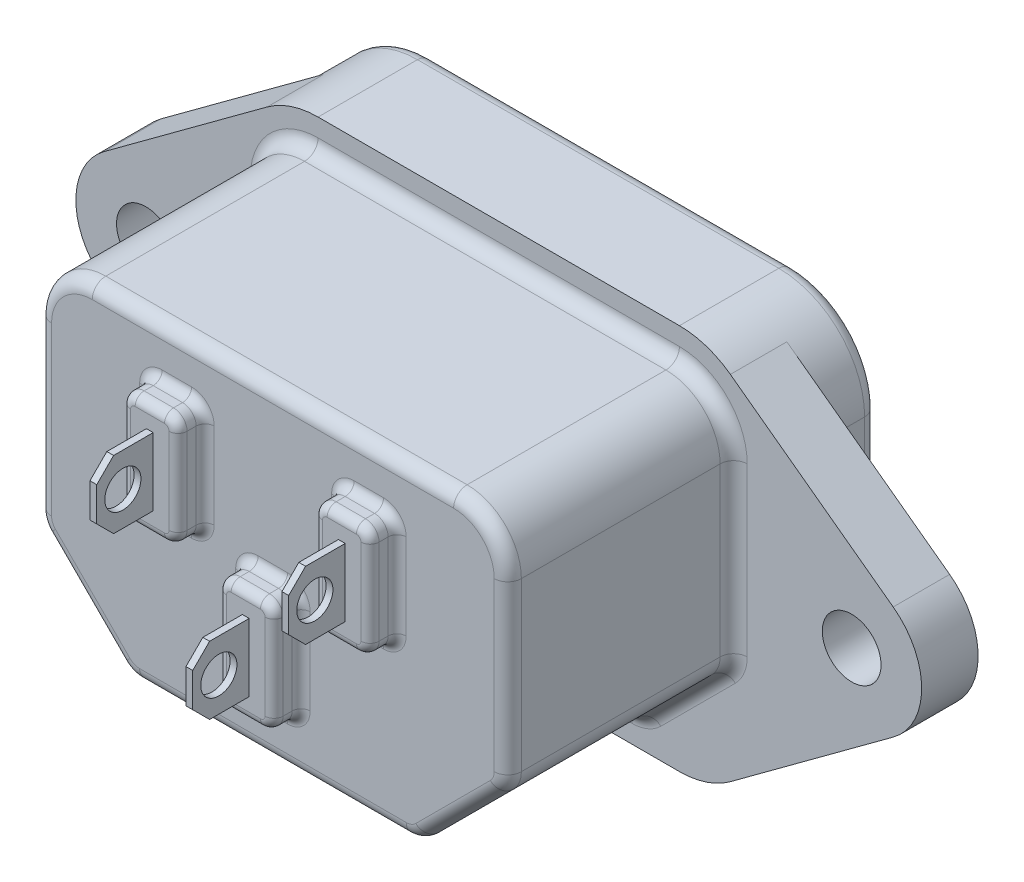
from build123d import *

# Parameters (mm, degrees)
BASE_EXTRUDE_DEPTH       = 3.175
BOSS_EXTRUDE1_START      = 3.175
SKETCH2_R                = 1.651
BOSS_EXTRUDE1_DEPTH      = 3.175
BOSS_EXTRUDE2_DEPTH      = 12.7
FILLET1_R                = 1.524
FILLET2_R                = 0.762
FILLET3_R                = 0.762
CUT_EXTRUDE1_DEPTH       = 16.891
FILLET4_R                = 0.762
FILLET5_R                = 0.762
BOSS_EXTRUDE3_DEPTH      = 1.524
FILLET6_R                = 0.508
BOSS_EXTRUDE4_DEPTH      = 3.175
BOSS_EXTRUDE4_DEPTH_BACK = 19.05
SKETCH6_W                = 1.905
SKETCH6_H                = 3.81
CUT_EXTRUDE2_START       = -3.175
CUT_EXTRUDE2_DEPTH       = 3.175
SKETCH8_R                = 1.016
CUT_EXTRUDE3_DEPTH       = 50.878764956
CUT_EXTRUDE4_START       = -10.16
CUT_EXTRUDE4_DEPTH       = 10.16


with BuildPart() as part:
    # Sketch1 → Base-Extrude (new body)
    with BuildSketch(Plane.XY):
        with BuildLine():
            Line((-54.229, 34.671), (-33.909, 34.671))
            ThreePointArc((-33.909, 34.671), (-30.496502674, 33.257497326), (-29.083, 29.845))
            Line((-29.083, 29.845), (-29.083, 17.78))
            ThreePointArc((-29.083, 17.78), (-30.496502674, 14.367502674), (-33.909, 12.954))
            Line((-33.909, 12.954), (-54.229, 12.954))
            ThreePointArc((-54.229, 12.954), (-57.641497326, 14.367502674), (-59.055, 17.78))
            Line((-59.055, 17.78), (-59.055, 29.845))
            ThreePointArc((-59.055, 29.845), (-57.641497326, 33.257497326), (-54.229, 34.671))
        make_face()
    extrude(amount=-BASE_EXTRUDE_DEPTH)

    # Sketch2 → Boss-Extrude1 (add)
    with BuildSketch(Plane.XY.offset(BOSS_EXTRUDE1_START)):
        with BuildLine():
            Line((-54.229, 12.954), (-33.909, 12.954))
            ThreePointArc((-33.909, 12.954), (-32.402074413, 13.195302488), (-31.045842939, 13.895079455))
            Line((-31.045842939, 13.895079455), (-21.889516608, 20.643222713))
            ThreePointArc((-21.889516608, 20.643222713), (-20.28825, 23.8125), (-21.889516608, 26.981777287))
            Line((-21.889516608, 26.981777287), (-31.045842939, 33.729920545))
            ThreePointArc((-31.045842939, 33.729920545), (-32.402074413, 34.429697512), (-33.909, 34.671))
            Line((-33.909, 34.671), (-54.229, 34.671))
            ThreePointArc((-54.229, 34.671), (-55.735925587, 34.429697512), (-57.092157061, 33.729920545))
            Line((-57.092157061, 33.729920545), (-66.248483392, 26.981777287))
            ThreePointArc((-66.248483392, 26.981777287), (-67.84975, 23.8125), (-66.248483392, 20.643222713))
            Line((-66.248483392, 20.643222713), (-57.092157061, 13.895079455))
            ThreePointArc((-57.092157061, 13.895079455), (-55.735925587, 13.195302488), (-54.229, 12.954))
        make_face()
        with Locations((-63.91275, 23.8125)):
            Circle(SKETCH2_R, mode=Mode.SUBTRACT)
        with Locations((-24.22525, 23.8125)):
            Circle(SKETCH2_R, mode=Mode.SUBTRACT)
    extrude(amount=-BOSS_EXTRUDE1_DEPTH)

    # Sketch3 → Boss-Extrude2 (add)
    with BuildSketch(Plane.XY.offset(3.175)):
        with BuildLine():
            Line((-30.861, 19.812), (-35.941, 14.732))
            Line((-35.941, 14.732), (-52.197, 14.732))
            Line((-52.197, 14.732), (-57.277, 19.812))
            Line((-57.277, 19.812), (-57.277, 29.845))
            ThreePointArc((-57.277, 29.845), (-56.384261469, 32.000261469), (-54.229, 32.893))
            Line((-54.229, 32.893), (-33.909, 32.893))
            ThreePointArc((-33.909, 32.893), (-31.753738531, 32.000261469), (-30.861, 29.845))
            Line((-30.861, 29.845), (-30.861, 19.812))
        make_face()
    extrude(amount=BOSS_EXTRUDE2_DEPTH)

    # Fillet1
    fillet1_edges = [part.edges().sort_by_distance(p)[0] for p in [
        (-57.277, 19.812, 9.525),
        (-52.197, 14.732, 9.525),
        (-35.941, 14.732, 9.525),
        (-30.861, 19.812, 9.525),
    ]]
    fillet(fillet1_edges, radius=FILLET1_R)

    # Fillet2
    fillet2_edges = [part.edges().sort_by_distance(p)[0] for p in [
        (-56.384261469, 32.000261469, 3.175),
        (-31.753738531, 32.000261469, 3.175),
        (-44.069, 32.893, 3.175),
        (-30.861, 25.144130735, 3.175),
        (-33.401, 17.272, 3.175),
        (-44.069, 14.732, 3.175),
        (-54.737, 17.272, 3.175),
        (-57.277, 25.144130735, 3.175),
        (-30.977007592, 19.860051918, 3.175),
        (-35.989051918, 14.848007592, 3.175),
        (-52.148948082, 14.848007592, 3.175),
        (-57.160992408, 19.860051918, 3.175),
    ]]
    fillet(fillet2_edges, radius=FILLET2_R)

    # Fillet3
    fillet3_edges = [part.edges().sort_by_distance(p)[0] for p in [
        (-57.641497326, 14.367502674, -3.175),
        (-44.069, 12.954, -3.175),
        (-30.496502674, 14.367502674, -3.175),
        (-29.083, 23.8125, -3.175),
        (-30.496502674, 33.257497326, -3.175),
        (-44.069, 34.671, -3.175),
        (-57.641497326, 33.257497326, -3.175),
        (-59.055, 23.8125, -3.175),
        (-30.861, 25.144130735, 15.875),
        (-44.069, 32.893, 15.875),
        (-56.384261469, 32.000261469, 15.875),
        (-31.753738531, 32.000261469, 15.875),
        (-33.401, 17.272, 15.875),
        (-57.277, 25.144130735, 15.875),
        (-54.737, 17.272, 15.875),
        (-44.069, 14.732, 15.875),
        (-57.160992408, 19.860051918, 15.875),
        (-52.148948082, 14.848007592, 15.875),
        (-35.989051918, 14.848007592, 15.875),
        (-30.977007592, 19.860051918, 15.875),
    ]]
    fillet(fillet3_edges, radius=FILLET3_R)

    # Sketch4 → Cut-Extrude1 (cut)
    with BuildSketch(Plane(origin=(0, 0, -3.175), x_dir=(-1, 0, 0), z_dir=(0, 0, -1))):
        with BuildLine():
            Line((55.499, 20.548471714), (51.460528286, 16.51))
            Line((51.460528286, 16.51), (36.677471714, 16.51))
            Line((36.677471714, 16.51), (32.639, 20.548471714))
            Line((32.639, 20.548471714), (32.639, 29.845))
            ThreePointArc((32.639, 29.845), (33.010974388, 30.743025612), (33.909, 31.115))
            Line((33.909, 31.115), (54.229, 31.115))
            ThreePointArc((54.229, 31.115), (55.127025612, 30.743025612), (55.499, 29.845))
            Line((55.499, 29.845), (55.499, 20.548471714))
        make_face()
    extrude(amount=-CUT_EXTRUDE1_DEPTH, mode=Mode.SUBTRACT)

    # Fillet4
    fillet4_edges = [part.edges().sort_by_distance(p)[0] for p in [
        (-55.499, 20.548471714, 5.2705),
        (-51.460528286, 16.51, 5.2705),
        (-36.677471714, 16.51, 5.2705),
        (-32.639, 20.548471714, 5.2705),
        (-33.010974388, 30.743025612, 13.716),
        (-55.127025612, 30.743025612, 13.716),
        (-55.499, 25.196735857, 13.716),
        (-53.479764143, 18.529235857, 13.716),
        (-44.069, 16.51, 13.716),
        (-34.658235857, 18.529235857, 13.716),
        (-32.639, 25.196735857, 13.716),
        (-44.069, 31.115, 13.716),
    ]]
    fillet(fillet4_edges, radius=FILLET4_R)

    # Fillet5
    fillet5_edges = [part.edges().sort_by_distance(p)[0] for p in [
        (-55.499, 25.354551224, -3.175),
        (-44.069, 31.115, -3.175),
        (-55.127025612, 30.743025612, -3.175),
        (-33.010974388, 30.743025612, -3.175),
        (-34.658235857, 18.529235857, -3.175),
        (-32.639, 25.354551224, -3.175),
        (-44.069, 16.51, -3.175),
        (-53.479764143, 18.529235857, -3.175),
        (-32.697003796, 20.572497673, -3.175),
        (-36.701497673, 16.568003796, -3.175),
        (-51.436502327, 16.568003796, -3.175),
        (-55.440996204, 20.572497673, -3.175),
    ]]
    fillet(fillet5_edges, radius=FILLET5_R)

    # Sketch5 → Boss-Extrude3 (add)
    with BuildSketch(Plane.XY.offset(15.875)):
        with BuildLine():
            Line((-50.292, 30.1625), (-48.641, 30.1625))
            ThreePointArc((-48.641, 30.1625), (-48.102184633, 29.939315367), (-47.879, 29.4005))
            Line((-47.879, 29.4005), (-47.879, 24.5745))
            ThreePointArc((-47.879, 24.5745), (-48.102184633, 24.035684633), (-48.641, 23.8125))
            Line((-48.641, 23.8125), (-50.292, 23.8125))
            ThreePointArc((-50.292, 23.8125), (-50.830815367, 24.035684633), (-51.054, 24.5745))
            Line((-51.054, 24.5745), (-51.054, 29.4005))
            ThreePointArc((-51.054, 29.4005), (-50.830815367, 29.939315367), (-50.292, 30.1625))
        make_face()
        with BuildLine():
            Line((-37.846, 30.1625), (-39.497, 30.1625))
            ThreePointArc((-39.497, 30.1625), (-40.035815367, 29.939315367), (-40.259, 29.4005))
            Line((-40.259, 29.4005), (-40.259, 24.5745))
            ThreePointArc((-40.259, 24.5745), (-40.035815367, 24.035684633), (-39.497, 23.8125))
            Line((-39.497, 23.8125), (-37.846, 23.8125))
            ThreePointArc((-37.846, 23.8125), (-37.307184633, 24.035684633), (-37.084, 24.5745))
            Line((-37.084, 24.5745), (-37.084, 29.4005))
            ThreePointArc((-37.084, 29.4005), (-37.307184633, 29.939315367), (-37.846, 30.1625))
        make_face()
        with BuildLine():
            Line((-43.2435, 23.8125), (-44.8945, 23.8125))
            ThreePointArc((-44.8945, 23.8125), (-45.433315367, 23.589315367), (-45.6565, 23.0505))
            Line((-45.6565, 23.0505), (-45.6565, 18.2245))
            ThreePointArc((-45.6565, 18.2245), (-45.433315367, 17.685684633), (-44.8945, 17.4625))
            Line((-44.8945, 17.4625), (-43.2435, 17.4625))
            ThreePointArc((-43.2435, 17.4625), (-42.704684633, 17.685684633), (-42.4815, 18.2245))
            Line((-42.4815, 18.2245), (-42.4815, 23.0505))
            ThreePointArc((-42.4815, 23.0505), (-42.704684633, 23.589315367), (-43.2435, 23.8125))
        make_face()
    extrude(amount=BOSS_EXTRUDE3_DEPTH)

    # Fillet6
    fillet6_edges = [part.edges().sort_by_distance(p)[0] for p in [
        (-42.704684633, 17.685684633, 15.875),
        (-42.4815, 20.6375, 17.399),
        (-42.704684633, 23.589315367, 17.399),
        (-44.069, 23.8125, 15.875),
        (-45.433315367, 23.589315367, 17.399),
        (-45.6565, 20.6375, 15.875),
        (-45.433315367, 17.685684633, 17.399),
        (-44.069, 17.4625, 15.875),
        (-42.704684633, 17.685684633, 17.399),
        (-44.069, 23.8125, 17.399),
        (-45.6565, 20.6375, 17.399),
        (-44.069, 17.4625, 17.399),
        (-45.433315367, 17.685684633, 15.875),
        (-45.433315367, 23.589315367, 15.875),
        (-42.704684633, 23.589315367, 15.875),
        (-42.4815, 20.6375, 15.875),
        (-48.102184633, 24.035684633, 17.399),
        (-47.879, 26.9875, 15.875),
        (-48.102184633, 29.939315367, 15.875),
        (-49.4665, 30.1625, 17.399),
        (-50.830815367, 29.939315367, 17.399),
        (-51.054, 26.9875, 15.875),
        (-50.830815367, 24.035684633, 17.399),
        (-49.4665, 23.8125, 17.399),
        (-47.879, 26.9875, 17.399),
        (-48.102184633, 29.939315367, 17.399),
        (-51.054, 26.9875, 17.399),
        (-48.102184633, 24.035684633, 15.875),
        (-49.4665, 23.8125, 15.875),
        (-50.830815367, 24.035684633, 15.875),
        (-50.830815367, 29.939315367, 15.875),
        (-49.4665, 30.1625, 15.875),
        (-40.035815367, 24.035684633, 15.875),
        (-38.6715, 23.8125, 15.875),
        (-37.307184633, 24.035684633, 15.875),
        (-37.084, 26.9875, 17.399),
        (-37.307184633, 29.939315367, 15.875),
        (-38.6715, 30.1625, 15.875),
        (-40.035815367, 29.939315367, 17.399),
        (-40.259, 26.9875, 17.399),
        (-40.035815367, 24.035684633, 17.399),
        (-38.6715, 23.8125, 17.399),
        (-37.307184633, 24.035684633, 17.399),
        (-37.307184633, 29.939315367, 17.399),
        (-38.6715, 30.1625, 17.399),
        (-40.259, 26.9875, 15.875),
        (-40.035815367, 29.939315367, 15.875),
        (-37.084, 26.9875, 15.875),
    ]]
    fillet(fillet6_edges, radius=FILLET6_R)

    # Sketch6 → Boss-Extrude4 (add, two sides: drawn at the far end of the back side and taken through both)
    with BuildSketch(Plane.XY.offset(17.399).offset(-BOSS_EXTRUDE4_DEPTH_BACK)):
        with Locations((-38.6715, 26.9875)):
            Rectangle(SKETCH6_W, SKETCH6_H)
        with Locations((-49.4665, 26.9875)):
            Rectangle(SKETCH6_W, SKETCH6_H)
        with Locations((-44.069, 20.6375)):
            Rectangle(SKETCH6_W, SKETCH6_H)
    extrude(amount=BOSS_EXTRUDE4_DEPTH + BOSS_EXTRUDE4_DEPTH_BACK)

    # Sketch7 → Cut-Extrude2 (cut)
    with BuildSketch(Plane.XY.offset(20.574).offset(CUT_EXTRUDE2_START)):
        with BuildLine():
            Line((-43.8785, 17.9705), (-43.2435, 17.9705))
            ThreePointArc((-43.2435, 17.9705), (-43.063894878, 18.044894878), (-42.9895, 18.2245))
            Line((-42.9895, 18.2245), (-42.9895, 23.0505))
            ThreePointArc((-42.9895, 23.0505), (-43.063894878, 23.230105122), (-43.2435, 23.3045))
            Line((-43.2435, 23.3045), (-43.8785, 23.3045))
            Line((-43.8785, 23.3045), (-43.8785, 17.9705))
        make_face()
        with BuildLine():
            Line((-38.862, 29.6545), (-38.862, 24.3205))
            Line((-38.862, 24.3205), (-39.497, 24.3205))
            ThreePointArc((-39.497, 24.3205), (-39.676605122, 24.394894878), (-39.751, 24.5745))
            Line((-39.751, 24.5745), (-39.751, 29.4005))
            ThreePointArc((-39.751, 29.4005), (-39.676605122, 29.580105122), (-39.497, 29.6545))
            Line((-39.497, 29.6545), (-38.862, 29.6545))
        make_face()
        with BuildLine():
            Line((-49.657, 24.3205), (-49.657, 29.6545))
            Line((-49.657, 29.6545), (-50.292, 29.6545))
            ThreePointArc((-50.292, 29.6545), (-50.471605122, 29.580105122), (-50.546, 29.4005))
            Line((-50.546, 29.4005), (-50.546, 24.5745))
            ThreePointArc((-50.546, 24.5745), (-50.471605122, 24.394894878), (-50.292, 24.3205))
            Line((-50.292, 24.3205), (-49.657, 24.3205))
        make_face()
        with BuildLine():
            Line((-44.2595, 23.3045), (-44.2595, 17.9705))
            Line((-44.2595, 17.9705), (-44.8945, 17.9705))
            ThreePointArc((-44.8945, 17.9705), (-45.074105122, 18.044894878), (-45.1485, 18.2245))
            Line((-45.1485, 18.2245), (-45.1485, 23.0505))
            ThreePointArc((-45.1485, 23.0505), (-45.074105122, 23.230105122), (-44.8945, 23.3045))
            Line((-44.8945, 23.3045), (-44.2595, 23.3045))
        make_face()
        with BuildLine():
            Line((-38.481, 24.3205), (-38.481, 29.6545))
            Line((-38.481, 29.6545), (-37.846, 29.6545))
            ThreePointArc((-37.846, 29.6545), (-37.666394878, 29.580105122), (-37.592, 29.4005))
            Line((-37.592, 29.4005), (-37.592, 24.5745))
            ThreePointArc((-37.592, 24.5745), (-37.666394878, 24.394894878), (-37.846, 24.3205))
            Line((-37.846, 24.3205), (-38.481, 24.3205))
        make_face()
        with BuildLine():
            Line((-49.276, 29.6545), (-49.276, 24.3205))
            Line((-49.276, 24.3205), (-48.641, 24.3205))
            ThreePointArc((-48.641, 24.3205), (-48.461394878, 24.394894878), (-48.387, 24.5745))
            Line((-48.387, 24.5745), (-48.387, 29.4005))
            ThreePointArc((-48.387, 29.4005), (-48.461394878, 29.580105122), (-48.641, 29.6545))
            Line((-48.641, 29.6545), (-49.276, 29.6545))
        make_face()
    extrude(amount=CUT_EXTRUDE2_DEPTH, mode=Mode.SUBTRACT)

    # Sketch8 → Cut-Extrude3 (cut, through all)
    with BuildSketch(Plane(origin=(-38.481, 0, 0), x_dir=(0, 0, -1), z_dir=(1, 0, 0))):
        with Locations((-19.106561258, 26.9875)):
            Circle(SKETCH8_R)
        with Locations((-19.106561258, 20.6375)):
            Circle(SKETCH8_R)
        Polygon((-17.399, 24.3205), (-21.336, 24.3205), (-21.336, 29.6545), (-17.399, 29.6545), (-17.399, 28.8925), (-19.625915563, 28.8925), (-20.574, 27.944415563), (-20.574, 26.030584437), (-19.625915563, 25.0825), (-17.399, 25.0825), align=None)
        Polygon((-21.336, 23.3045), (-17.399, 23.3045), (-17.399, 22.5425), (-19.625915563, 22.5425), (-20.574, 21.594415563), (-20.574, 19.680584437), (-19.625915563, 18.7325), (-17.399, 18.7325), (-17.399, 17.9705), (-21.336, 17.9705), align=None)
    extrude(amount=-CUT_EXTRUDE3_DEPTH, mode=Mode.SUBTRACT)

    # Sketch9 → Cut-Extrude4 (cut)
    with BuildSketch(Plane(origin=(0, 28.8925, 0), x_dir=(-1, 0, 0), z_dir=(0, 1, 0)).offset(CUT_EXTRUDE4_START)):
        Polygon((50.865682877, 0.829695137), (50.646744509, 0.829695137), (49.4665, -2.413), (48.286255491, 0.829695137), (45.249244509, 0.829695137), (44.069, -2.413), (42.888755491, 0.829695137), (39.851744509, 0.829695137), (38.6715, -2.413), (37.491255491, 0.829695137), (37.272317123, 0.829695137), (37.272317123, -2.786920493), (50.865682877, -2.786920493), align=None)
    extrude(amount=CUT_EXTRUDE4_DEPTH, mode=Mode.SUBTRACT)


solid = part.part
